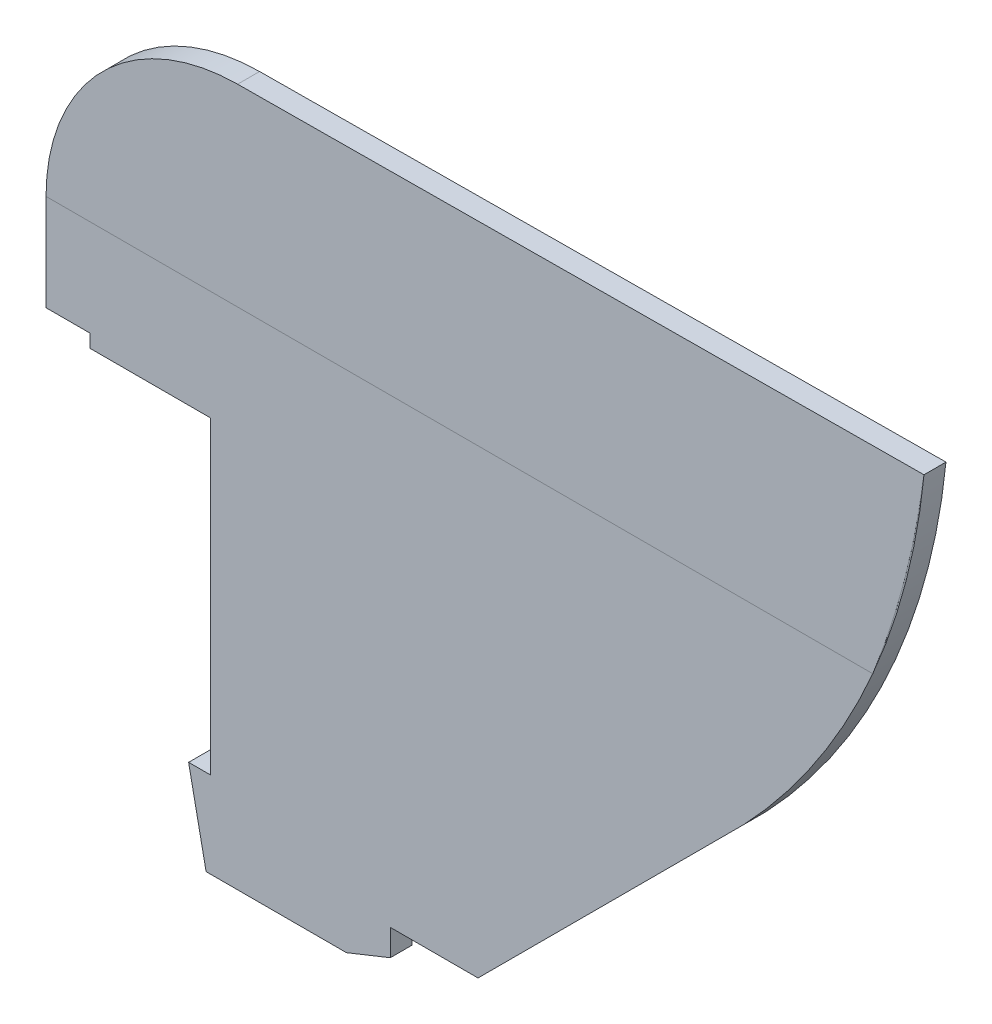
from build123d import *

# Parameters (mm, degrees)
BOSS_EXTRU_1_DEPTH      = 5
BOSS_EXTRU_2_DEPTH      = 0.01
ESQUISSE3_W             = 10
ESQUISSE3_H             = 3
ENL_V_MAT_EXTRU_1_DEPTH = 231.967242256
ENL_V_MAT_EXTRU_2_DEPTH = 231.967242256


with BuildPart() as part:
    # Esquisse1 → Boss.-Extru.1 (new body)
    with BuildSketch(Plane.XY):
        with BuildLine():
            Line((0, 0), (0, -25))
            Line((0, -25), (37.5, -25))
            Line((37.5, -25), (37.5, -95.5))
            Line((37.5, -95.5), (32.5, -95.5))
            Line((32.5, -95.5), (36.487358688, -115.098494092))
            Line((36.487358688, -115.098494092), (88.487358688, -115.098494092))
            Line((88.487358688, -115.098494092), (159.198036807, -44.387815974))
            ThreePointArc((159.198036807, -44.387815974), (187.146342861, -3.044299659), (200.182925478, 45.126663235))
            Line((200.182925478, 45.126663235), (43.682925478, 43.998857528))
            ThreePointArc((43.682925478, 43.998857528), (12.775400091, 31.000392909), (0, 0))
        make_face()
    extrude(amount=BOSS_EXTRU_1_DEPTH)

    # Esquisse2 → Boss.-Extru.2 (add)
    with BuildSketch(Plane.XY.offset(5)):
        with BuildLine():
            Line((0, 0), (188.5, 0))
            ThreePointArc((188.5, 0), (195.764398976, 22.194945018), (200.182925478, 45.126663235))
            Line((200.182925478, 45.126663235), (43.682925478, 43.998857528))
            ThreePointArc((43.682925478, 43.998857528), (12.775400091, 31.000392909), (0, 0))
        make_face()
    extrude(amount=BOSS_EXTRU_2_DEPTH)

    # Esquisse3 → Enlèv. mat.-Extru.1 (cut, through all)
    with BuildSketch(Plane.XY.offset(5)):
        with Locations((5, -23.5)):
            Rectangle(ESQUISSE3_W, ESQUISSE3_H)
    extrude(amount=-ENL_V_MAT_EXTRU_1_DEPTH, mode=Mode.SUBTRACT)

    # Esquisse4 → Enlèv. mat.-Extru.2 (cut, through all)
    with BuildSketch(Plane.XY.offset(5)):
        Polygon((88.487358688, -105.098494092), (78.487358688, -105.098494092), (78.487358688, -111.098494092), (68.487358688, -115.098494092), (78.487358688, -115.098494092), (88.487358688, -115.098494092), (98.487358688, -105.098494092), align=None)
    extrude(amount=-ENL_V_MAT_EXTRU_2_DEPTH, mode=Mode.SUBTRACT)


solid = part.part
